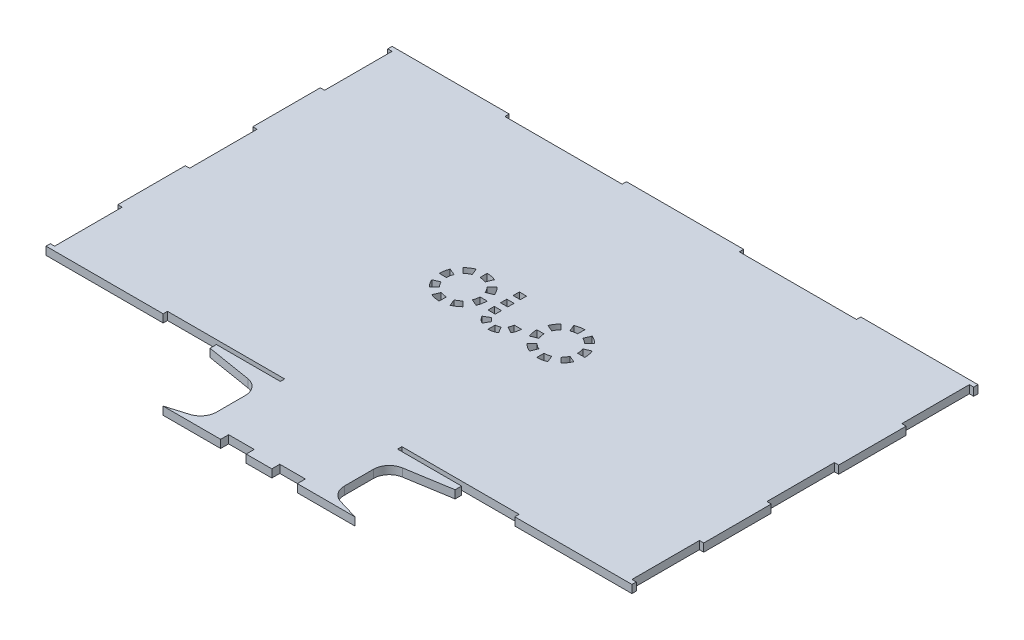
from build123d import *

# Parameters (mm, degrees)
BOSS_EXTRUDE1_DEPTH = 5


with BuildPart() as part:
    # Sketch1 → Boss-Extrude1 (new body)
    with BuildSketch(Plane(origin=(0, 0, 0), x_dir=(1, 0, 0), z_dir=(0, 1, 0))):
        with BuildLine():
            Line((-183.2, 108.2), (-109.92, 108.2))
            Line((-109.92, 108.2), (-109.92, 105.5))
            Line((-109.92, 105.5), (-36.64, 105.5))
            Line((-36.64, 105.5), (-36.64, 108.2))
            Line((-36.64, 108.2), (36.64, 108.2))
            Line((36.64, 108.2), (36.64, 105.5))
            Line((36.64, 105.5), (109.92, 105.5))
            Line((109.92, 105.5), (109.92, 108.2))
            Line((109.92, 108.2), (183.2, 108.2))
            Line((183.2, 108.2), (183.2, 105.5))
            Line((183.2, 105.5), (180.5, 105.5))
            Line((180.5, 105.5), (180.5, 63.3))
            Line((180.5, 63.3), (183.2, 63.3))
            Line((183.2, 63.3), (183.2, 21.1))
            Line((183.2, 21.1), (180.5, 21.1))
            Line((180.5, 21.1), (180.5, -21.1))
            Line((180.5, -21.1), (183.2, -21.1))
            Line((183.2, -21.1), (183.2, -63.3))
            Line((183.2, -63.3), (180.5, -63.3))
            Line((180.5, -63.3), (180.5, -105.5))
            Line((180.5, -105.5), (183.2, -105.5))
            Line((183.2, -105.5), (183.2, -108.2))
            Line((183.2, -108.2), (109.92, -108.2))
            Line((109.92, -108.2), (109.92, -105.5))
            Line((109.92, -105.5), (36.64, -105.5))
            Line((36.64, -105.5), (36.64, -108.2))
            Line((36.64, -108.2), (76.64, -108.2))
            Line((76.64, -108.2), (76.64, -112.2))
            Line((76.64, -112.2), (48.383969685, -116.8270792))
            ThreePointArc((48.383969685, -116.8270792), (42.378966502, -120.22108374), (40, -126.695637657))
            Line((40, -126.695637657), (40, -144.759693491))
            ThreePointArc((40, -144.759693491), (41.977070717, -150.728998787), (47.126521144, -154.337956343))
            Line((47.126521144, -154.337956343), (60, -158.2))
            Line((60, -158.2), (40, -158.2))
            Line((40, -158.2), (24, -158.2))
            Line((24, -158.2), (24, -153.2))
            Line((24, -153.2), (8, -153.2))
            Line((8, -153.2), (8, -158.2))
            Line((8, -158.2), (-8, -158.2))
            Line((-8, -158.2), (-8, -153.2))
            Line((-8, -153.2), (-24, -153.2))
            Line((-24, -153.2), (-24, -158.2))
            Line((-24, -158.2), (-40, -158.2))
            Line((-40, -158.2), (-60, -158.2))
            Line((-60, -158.2), (-47.126521144, -154.337956343))
            ThreePointArc((-47.126521144, -154.337956343), (-41.977070717, -150.728998787), (-40, -144.759693491))
            Line((-40, -144.759693491), (-40, -126.695637657))
            ThreePointArc((-40, -126.695637657), (-42.378966502, -120.22108374), (-48.383969685, -116.8270792))
            Line((-48.383969685, -116.8270792), (-76.64, -112.2))
            Line((-76.64, -112.2), (-76.64, -108.2))
            Line((-76.64, -108.2), (-36.64, -108.2))
            Line((-36.64, -108.2), (-36.64, -105.5))
            Line((-36.64, -105.5), (-109.92, -105.5))
            Line((-109.92, -105.5), (-109.92, -108.2))
            Line((-109.92, -108.2), (-183.2, -108.2))
            Line((-183.2, -108.2), (-183.2, -105.5))
            Line((-183.2, -105.5), (-180.5, -105.5))
            Line((-180.5, -105.5), (-180.5, -63.3))
            Line((-180.5, -63.3), (-183.2, -63.3))
            Line((-183.2, -63.3), (-183.2, -21.1))
            Line((-183.2, -21.1), (-180.5, -21.1))
            Line((-180.5, -21.1), (-180.5, 21.1))
            Line((-180.5, 21.1), (-183.2, 21.1))
            Line((-183.2, 21.1), (-183.2, 63.3))
            Line((-183.2, 63.3), (-180.5, 63.3))
            Line((-180.5, 63.3), (-180.5, 105.5))
            Line((-180.5, 105.5), (-183.2, 105.5))
            Line((-183.2, 105.5), (-183.2, 108.2))
        make_face()
        Polygon((-10.416027214, 3.248752874), (-10.416027214, 7.165835249), (-5.901936844, 7.165835249), (-5.905104227, 3.248752874), align=None, mode=Mode.SUBTRACT)
        Polygon((-10.416027214, 11.082917625), (-10.416027214, 15), (-5.895602079, 15), (-5.898769461, 11.082917625), align=None, mode=Mode.SUBTRACT)
        with BuildLine():
            Line((-9.020736962, -9.792705988), (-5.119649128, -7.540411877))
            ThreePointArc((-5.119649128, -7.540411877), (-4.180440069, -8.764412954), (-2.956438992, -9.703622014))
            Line((-2.956438992, -9.703622014), (-5.208733103, -13.604709848))
            ThreePointArc((-5.208733103, -13.604709848), (-7.365664947, -11.949637832), (-9.020736962, -9.792705988))
        make_face(mode=Mode.SUBTRACT)
        with BuildLine():
            Line((-0.001438992, -10.495411877), (-0.001438992, -15.000000099))
            ThreePointArc((-0.001438992, -15.000000099), (2.694054787, -14.645131611), (5.205855119, -13.604709848))
            Line((5.205855119, -13.604709848), (2.953561008, -9.703622014))
            ThreePointArc((2.953561008, -9.703622014), (1.528181564, -10.294033511), (-0.001438992, -10.495411877))
        make_face(mode=Mode.SUBTRACT)
        with BuildLine():
            Line((5.116771144, -7.540411877), (9.017858978, -9.792705988))
            ThreePointArc((9.017858978, -9.792705988), (10.058280742, -7.280905656), (10.41314923, -4.585411877))
            Line((10.41314923, -4.585411877), (5.908561008, -4.585411877))
            ThreePointArc((5.908561008, -4.585411877), (5.707182641, -6.115032434), (5.116771144, -7.540411877))
        make_face(mode=Mode.SUBTRACT)
        Polygon((-5.911438992, -4.585411877), (-10.416027214, -4.585411877), (-10.416027214, -0.668329502), (-5.908271609, -0.668329502), align=None, mode=Mode.SUBTRACT)
        with BuildLine():
            Line((-24.787499543, -13.858192988), (-26.509574989, -9.700735091))
            ThreePointArc((-26.509574989, -9.700735091), (-24.694263582, -8.730430929), (-23.103129826, -7.424621202))
            Line((-23.103129826, -7.424621202), (-19.921149311, -10.606601718))
            ThreePointArc((-19.921149311, -10.606601718), (-22.194197533, -12.472044185), (-24.787499543, -13.858192988))
        make_face(mode=Mode.SUBTRACT)
        with BuildLine():
            Line((-15.527751029, 0), (-20.027751029, 0))
            ThreePointArc((-20.027751029, 0), (-20.229505584, -2.048448381), (-20.827015937, -4.01817604))
            Line((-20.827015937, -4.01817604), (-16.669558041, -5.740251485))
            ThreePointArc((-16.669558041, -5.740251485), (-15.815971823, -2.92635483), (-15.527751029, 0))
        make_face(mode=Mode.SUBTRACT)
        with BuildLine():
            Line((-19.921149311, 10.606601718), (-23.103129826, 7.424621202))
            ThreePointArc((-23.103129826, 7.424621202), (-21.7973201, 5.833487447), (-20.827015937, 4.01817604))
            Line((-20.827015937, 4.01817604), (-16.669558041, 5.740251485))
            ThreePointArc((-16.669558041, 5.740251485), (-18.055706844, 8.333553495), (-19.921149311, 10.606601718))
        make_face(mode=Mode.SUBTRACT)
        with BuildLine():
            Line((-30.527751029, 15), (-30.527751029, 10.5))
            ThreePointArc((-30.527751029, 10.5), (-28.479302648, 10.298245444), (-26.509574989, 9.700735091))
            Line((-26.509574989, 9.700735091), (-24.787499543, 13.858192988))
            ThreePointArc((-24.787499543, 13.858192988), (-27.601396198, 14.711779206), (-30.527751029, 15))
        make_face(mode=Mode.SUBTRACT)
        with BuildLine():
            Line((-37.952372231, 7.424621202), (-41.134352746, 10.606601718))
            ThreePointArc((-41.134352746, 10.606601718), (-38.861304524, 12.472044185), (-36.268002514, 13.858192988))
            Line((-36.268002514, 13.858192988), (-34.545927069, 9.700735091))
            ThreePointArc((-34.545927069, 9.700735091), (-36.361238475, 8.730430929), (-37.952372231, 7.424621202))
        make_face(mode=Mode.SUBTRACT)
        with BuildLine():
            Line((-41.027751029, 0), (-45.527751029, 0))
            ThreePointArc((-45.527751029, 0), (-45.239530235, 2.92635483), (-44.385944016, 5.740251485))
            Line((-44.385944016, 5.740251485), (-40.22848612, 4.01817604))
            ThreePointArc((-40.22848612, 4.01817604), (-40.825996473, 2.048448381), (-41.027751029, 0))
        make_face(mode=Mode.SUBTRACT)
        with BuildLine():
            Line((-37.952372231, -7.424621202), (-41.134352746, -10.606601718))
            ThreePointArc((-41.134352746, -10.606601718), (-42.999795213, -8.333553495), (-44.385944016, -5.740251485))
            Line((-44.385944016, -5.740251485), (-40.22848612, -4.01817604))
            ThreePointArc((-40.22848612, -4.01817604), (-39.258181958, -5.833487447), (-37.952372231, -7.424621202))
        make_face(mode=Mode.SUBTRACT)
        with BuildLine():
            Line((-30.527751029, -10.5), (-30.527751029, -15))
            ThreePointArc((-30.527751029, -15), (-33.454105859, -14.711779206), (-36.268002514, -13.858192988))
            Line((-36.268002514, -13.858192988), (-34.545927069, -9.700735091))
            ThreePointArc((-34.545927069, -9.700735091), (-32.57619941, -10.298245444), (-30.527751029, -10.5))
        make_face(mode=Mode.SUBTRACT)
        with BuildLine():
            Line((24.787499543, -13.858192988), (26.509574989, -9.700735091))
            ThreePointArc((26.509574989, -9.700735091), (24.694263582, -8.730430929), (23.103129826, -7.424621202))
            Line((23.103129826, -7.424621202), (19.921149311, -10.606601718))
            ThreePointArc((19.921149311, -10.606601718), (22.194197533, -12.472044185), (24.787499543, -13.858192988))
        make_face(mode=Mode.SUBTRACT)
        with BuildLine():
            Line((30.527751029, -10.5), (30.527751029, -15))
            ThreePointArc((30.527751029, -15), (33.454105859, -14.711779206), (36.268002514, -13.858192988))
            Line((36.268002514, -13.858192988), (34.545927069, -9.700735091))
            ThreePointArc((34.545927069, -9.700735091), (32.57619941, -10.298245444), (30.527751029, -10.5))
        make_face(mode=Mode.SUBTRACT)
        with BuildLine():
            Line((37.952372231, -7.424621202), (41.134352746, -10.606601718))
            ThreePointArc((41.134352746, -10.606601718), (42.999795213, -8.333553495), (44.385944016, -5.740251485))
            Line((44.385944016, -5.740251485), (40.22848612, -4.01817604))
            ThreePointArc((40.22848612, -4.01817604), (39.258181958, -5.833487447), (37.952372231, -7.424621202))
        make_face(mode=Mode.SUBTRACT)
        with BuildLine():
            Line((41.027751029, 0), (45.527751029, 0))
            ThreePointArc((45.527751029, 0), (45.239530235, 2.92635483), (44.385944016, 5.740251485))
            Line((44.385944016, 5.740251485), (40.22848612, 4.01817604))
            ThreePointArc((40.22848612, 4.01817604), (40.825996473, 2.048448381), (41.027751029, 0))
        make_face(mode=Mode.SUBTRACT)
        with BuildLine():
            Line((37.952372231, 7.424621202), (41.134352746, 10.606601718))
            ThreePointArc((41.134352746, 10.606601718), (38.861304524, 12.472044185), (36.268002514, 13.858192988))
            Line((36.268002514, 13.858192988), (34.545927069, 9.700735091))
            ThreePointArc((34.545927069, 9.700735091), (36.361238475, 8.730430929), (37.952372231, 7.424621202))
        make_face(mode=Mode.SUBTRACT)
        with BuildLine():
            Line((30.527751029, 15), (30.527751029, 10.5))
            ThreePointArc((30.527751029, 10.5), (28.479302648, 10.298245444), (26.509574989, 9.700735091))
            Line((26.509574989, 9.700735091), (24.787499543, 13.858192988))
            ThreePointArc((24.787499543, 13.858192988), (27.601396198, 14.711779206), (30.527751029, 15))
        make_face(mode=Mode.SUBTRACT)
        with BuildLine():
            Line((19.921149311, 10.606601718), (23.103129826, 7.424621202))
            ThreePointArc((23.103129826, 7.424621202), (21.7973201, 5.833487447), (20.827015937, 4.01817604))
            Line((20.827015937, 4.01817604), (16.669558041, 5.740251485))
            ThreePointArc((16.669558041, 5.740251485), (18.055706844, 8.333553495), (19.921149311, 10.606601718))
        make_face(mode=Mode.SUBTRACT)
        with BuildLine():
            Line((15.527751029, 0), (20.027751029, 0))
            ThreePointArc((20.027751029, 0), (20.229505584, -2.048448381), (20.827015937, -4.01817604))
            Line((20.827015937, -4.01817604), (16.669558041, -5.740251485))
            ThreePointArc((16.669558041, -5.740251485), (15.815971823, -2.92635483), (15.527751029, 0))
        make_face(mode=Mode.SUBTRACT)
    extrude(amount=BOSS_EXTRUDE1_DEPTH)


solid = part.part
